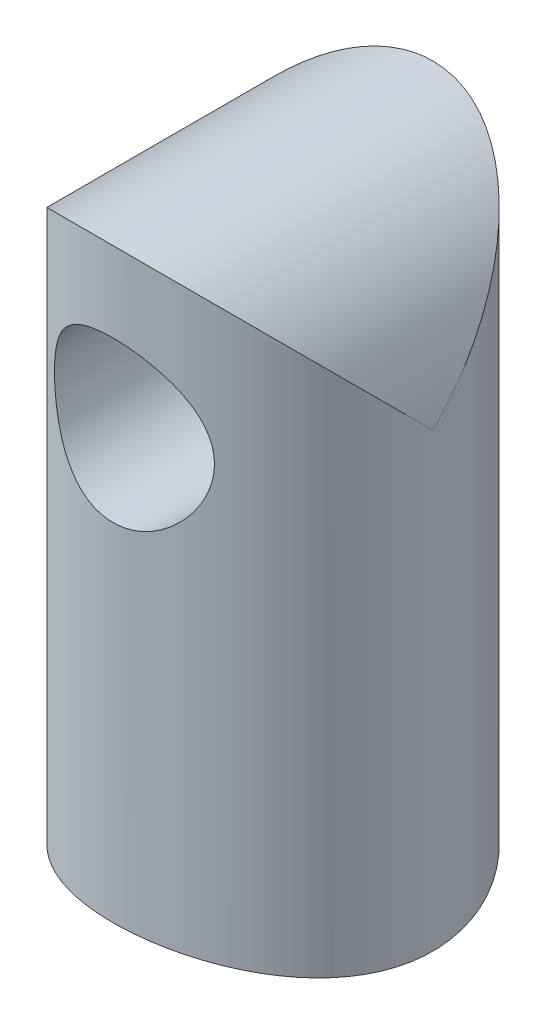
from build123d import *

# Parameters (mm, degrees)
SKETCH1_R               = 9.525
BOSS_EXTRUDE1_DEPTH     = 38.1
CUT_EXTRUDE1_DEPTH      = 41.411152545
CUT_EXTRUDE1_DEPTH_BACK = 41.411152545
SKETCH2_R               = 31.75
SKETCH2_R_2             = 4.7625


with BuildPart() as part:
    # Sketch1 → Boss-Extrude1 (new body)
    with BuildSketch(Plane(origin=(0, 0, 0), x_dir=(1, 0, 0), z_dir=(0, 1, 0))):
        Circle(SKETCH1_R)
    extrude(amount=BOSS_EXTRUDE1_DEPTH)

    # Sketch2 → Cut-Extrude1 (cut, two sides: drawn at the far end of the back side and taken through both)
    with BuildSketch(Plane.XY.offset(-CUT_EXTRUDE1_DEPTH_BACK)):
        with Locations((0, -30.287569645)):
            Circle(SKETCH2_R)
        with Locations((0, 26.862430355)):
            Circle(SKETCH2_R_2)
        with BuildLine():
            Line((-9.525, 26.862430355), (-9.525, 38.1))
            Line((-9.525, 38.1), (9.525, 38.1))
            Line((9.525, 38.1), (9.525, 26.862430355))
            ThreePointArc((9.525, 26.862430355), (0, 36.387430355), (-9.525, 26.862430355))
        make_face()
    extrude(amount=CUT_EXTRUDE1_DEPTH + CUT_EXTRUDE1_DEPTH_BACK, mode=Mode.SUBTRACT)


solid = part.part
